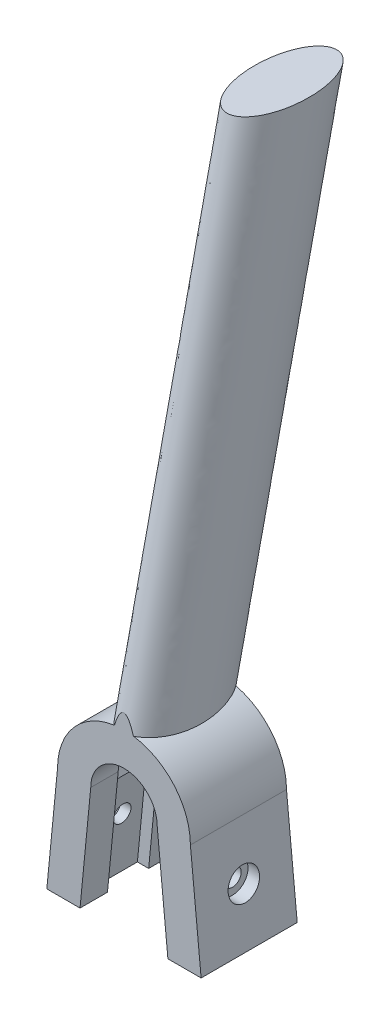
from build123d import *

# Parameters (mm, degrees)
BOSS_EXTRUDE1_DEPTH         = 3.75
BOLT_HOLE_REACH             = 26.729
SKETCH2_R                   = 1.6
BOLT_HOLE_DIRECTION_2_REACH = 26.729
BOSS_EXTRUDE2_START         = 5
BOSS_EXTRUDE2_DEPTH         = 5
CUT_EXTRUDE2_START          = 11
SKETCH4_R                   = 2.85
CUT_EXTRUDE2_DEPTH          = 3
SKETCH7_RX                  = 10
SKETCH7_RY                  = 5
SKETCH11_W                  = 7.251223943
SKETCH11_H                  = 3.177760732
CUT_EXTRUDE3_DEPTH          = 20
CUT_EXTRUDE7_START          = -11
CUT_EXTRUDE7_DEPTH          = 10
CUT_EXTRUDE8_START          = -1.25
CUT_EXTRUDE8_DEPTH          = 1.828931


with BuildPart() as part:
    # Sketch1 → Boss-Extrude1 (new, symmetric)
    with BuildSketch(Plane.XY):
        with BuildLine():
            Line((-12.1, 0), (-14.051700625, -20))
            Line((-14.051700625, -20), (-10.051700625, -20))
            Line((-10.051700625, -20), (-8.425, -3.439385846))
            ThreePointArc((-8.425, -3.439385846), (0, 9.1), (8.425, -3.439385846))
            Line((8.425, -3.439385846), (10.051700625, -20))
            Line((10.051700625, -20), (14.051700625, -20))
            Line((14.051700625, -20), (12.1, 0))
            ThreePointArc((12.1, 0), (0, 12.1), (-12.1, 0))
        make_face()
    extrude(amount=BOSS_EXTRUDE1_DEPTH, both=True)

    # Bolt Hole: up to this plane
    bolt_hole_end = Plane(origin=(14.051700625, -20, 3.75), z_dir=(-0.995272319868323, -0.09712368044883128, 0))
    # Sketch2 → Bolt Hole (cut, up to the surface)
    with BuildSketch(Plane(origin=(0, 0, 0), x_dir=(0, 0, -1), z_dir=(1, 0, 0)), mode=Mode.PRIVATE) as bolt_hole_sk1:
        with Locations(Location((0, -10, 0), (0, 0, 90))):
            Circle(SKETCH2_R)
    bolt_hole_tool1 = split(extrude(bolt_hole_sk1.sketch, amount=BOLT_HOLE_REACH, mode=Mode.PRIVATE), bisect_by=bolt_hole_end, keep=Keep.BOTH, mode=Mode.PRIVATE)
    add(bolt_hole_tool1.solids().sort_by_distance((0, -10, 0))[0], mode=Mode.SUBTRACT)

    # Bolt Hole direction 2: up to this plane
    bolt_hole_direction_2_end = Plane(origin=(-12.1, 0, 3.75), z_dir=(0.995272319868323, -0.09712368044883138, 0))
    # Sketch2 → Bolt Hole direction 2 (cut, up to the surface)
    with BuildSketch(Plane(origin=(0, 0, 0), x_dir=(0, 0, -1), z_dir=(1, 0, 0)), mode=Mode.PRIVATE) as bolt_hole_direction_2_sk1:
        with Locations(Location((0, -10, 0), (0, 0, 90))):
            Circle(SKETCH2_R)
    bolt_hole_direction_2_tool1 = split(extrude(bolt_hole_direction_2_sk1.sketch, amount=-BOLT_HOLE_DIRECTION_2_REACH, mode=Mode.PRIVATE), bisect_by=bolt_hole_direction_2_end, keep=Keep.BOTH, mode=Mode.PRIVATE)
    add(bolt_hole_direction_2_tool1.solids().sort_by_distance((0, -10, 0))[0], mode=Mode.SUBTRACT)

    # Sketch3 → Boss-Extrude2 (add)
    with BuildSketch(Plane.XY.offset(3.75).offset(BOSS_EXTRUDE2_START)):
        with BuildLine():
            ThreePointArc((12.1, 0), (0, 12.1), (-12.1, 0))
            Line((-12.1, 0), (-6.05, 0))
            ThreePointArc((-6.05, 0), (0, 6.05), (6.05, 0))
            Line((6.05, 0), (12.1, 0))
        make_face()
        Polygon((-6.05, 0), (-12.1, 0), (-14.051700625, -20), (-8.001700625, -20), align=None)
        Polygon((14.051700625, -20), (12.1, 0), (6.05, 0), (8.001700625, -20), align=None)
    boss_extrude2 = extrude(amount=-BOSS_EXTRUDE2_DEPTH)

    # Sketch4 → Cut-Extrude2 (cut)
    with BuildSketch(Plane(origin=(0, 0, 0), x_dir=(0, 0, -1), z_dir=(1, 0, 0)).offset(CUT_EXTRUDE2_START)):
        with Locations(Location((0, -10, 0), (0, 0, 90))):
            Circle(SKETCH4_R)
    extrude(amount=CUT_EXTRUDE2_DEPTH, mode=Mode.SUBTRACT)

    # Sweep1: sweep along a path in Sketch8
    with BuildLine(Plane(origin=(0, 0, 0), x_dir=(0, 0, -1), z_dir=(1, 0, 0))) as sweep1_path:
        Line((20, 100), (0, 9.1))
    # Sketch7 → Sweep1 (sweep)
    with BuildSketch(Plane(origin=(0, 100, 0), x_dir=(1, 0, 0), z_dir=(0, 1, 0))):
        with Locations(Location((0, 20), (0, 0, -90))):
            Ellipse(SKETCH7_RX, SKETCH7_RY)
    sweep(path=sweep1_path.line)

    # Mirror2: Boss-Extrude2 across plane
    add(boss_extrude2.mirror(Plane.XY))

    # Sweep2: read off the stored shape, not the designer's step
    # Sweep2: loft between two sections, ruled curve by curve
    sweep2_from = [
        Edge.make_bspline([(-2.420614591, 9.1, -8.75), (-0.880223488, 9.1, -10.454545455), (0.880223488, 9.1, -10.454545455), (2.420614591, 9.1, -8.75)], [0, 0, 0, 0, 1, 1, 1, 1], 3, [1, 0.916666667, 0.916666667, 1]),
        Edge.make_line((2.420614591, 9.1, -8.75), (-2.420614591, 9.1, -8.75)),
    ]
    sweep2_to = [
        Edge.make_bspline([(-2.420614591, 3.41875, -7.5), (-0.880223488, 3.41875, -9.204545455), (0.880223488, 3.41875, -9.204545455), (2.420614591, 3.41875, -7.5)], [0, 0, 0, 0, 1, 1, 1, 1], 3, [1, 0.916666667, 0.916666667, 1]),
        Edge.make_line((2.420614591, 3.41875, -7.5), (-2.420614591, 3.41875, -7.5)),
    ]
    sweep2 = Solid(Shell([*[Face.make_surface_from_curves(sweep2_from[k], sweep2_to[k]) for k in range(2)], Face(Wire(sweep2_from)), Face(Wire(sweep2_to))]))
    add(sweep2)

    # Sketch11 → Cut-Extrude3 (cut)
    with BuildSketch(Plane(origin=(0, 0, 0), x_dir=(1, 0, 0), z_dir=(0, 1, 0))):
        with Locations((-0.008642554, -10.338880366)):
            Rectangle(SKETCH11_W, SKETCH11_H)
    extrude(amount=CUT_EXTRUDE3_DEPTH, mode=Mode.SUBTRACT)

    # Sketch14 → Cut-Extrude7 (cut)
    with BuildSketch(Plane(origin=(0, 0, 0), x_dir=(0, 0, -1), z_dir=(1, 0, 0)).offset(CUT_EXTRUDE7_START)):
        Polygon((-3.233161507, -10), (-1.616580754, -12.8), (1.616580754, -12.8), (3.233161507, -10), (1.616580754, -7.2), (-1.616580754, -7.2), align=None)
    extrude(amount=-CUT_EXTRUDE7_DEPTH, mode=Mode.SUBTRACT)

    # Sketch18 → Cut-Extrude8 (cut)
    with BuildSketch(Plane(origin=(0, 0, -8.75), x_dir=(-1, 0, 0), z_dir=(0, 0, -1)).offset(CUT_EXTRUDE8_START)):
        with BuildLine():
            Line((-6.05, 0), (6.05, 0))
            ThreePointArc((6.05, 0), (0, 6.05), (-6.05, 0))
        make_face()
    extrude(amount=CUT_EXTRUDE8_DEPTH, mode=Mode.SUBTRACT)


solid = part.part
